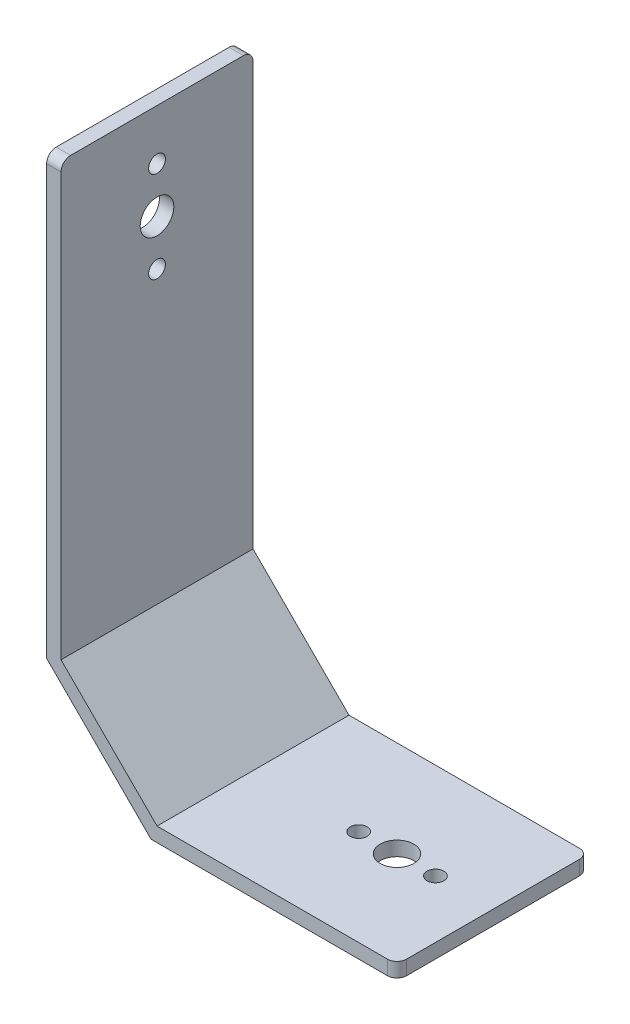
from build123d import *

# Parameters (mm, degrees)
EXTRU_MINCE1_DEPTH      = 40
ESQUISSE2_R             = 1.75
ESQUISSE2_R_2           = 3.5
ENL_V_MAT_EXTRU_1_DEPTH = 3
CONG_3_R                = 2
CONG_4_R                = 2
CONG_5_R                = 2
CONG_6_R                = 2
ESQUISSE3_R             = 1.75
ESQUISSE3_R_2           = 3.5
ENL_V_MAT_EXTRU_2_DEPTH = 50


with BuildPart() as part:
    # Esquisse1 → Extru.-Mince1 (new body)
    with BuildSketch(Plane.XY):
        Polygon((70, -20), (20, -20), (0, 0), (0, 90), (-3, 90), (-3, -1.242640687), (18.757359313, -23), (70, -23), align=None)
    extrude(amount=EXTRU_MINCE1_DEPTH)

    # Esquisse2 → Enlèv. mat.-Extru.1 (cut)
    with BuildSketch(Plane(origin=(0, 0, 0), x_dir=(0, 0, -1), z_dir=(1, 0, 0))):
        with Locations((-20, 79.5)):
            Circle(ESQUISSE2_R)
        with Locations((-20, 60.5)):
            Circle(ESQUISSE2_R)
        with Locations((-20, 70)):
            Circle(ESQUISSE2_R_2)
    extrude(amount=-ENL_V_MAT_EXTRU_1_DEPTH, mode=Mode.SUBTRACT)

    # Congé3
    cong_3_edges = [part.edges().sort_by_distance(p)[0] for p in [
        (-1.5, 90, 40),
    ]]
    fillet(cong_3_edges, radius=CONG_3_R)

    # Congé4
    cong_4_edges = [part.edges().sort_by_distance(p)[0] for p in [
        (-1.5, 90, 0),
    ]]
    fillet(cong_4_edges, radius=CONG_4_R)

    # Congé5
    cong_5_edges = [part.edges().sort_by_distance(p)[0] for p in [
        (70, -21.5, 40),
    ]]
    fillet(cong_5_edges, radius=CONG_5_R)

    # Congé6
    cong_6_edges = [part.edges().sort_by_distance(p)[0] for p in [
        (70, -21.5, 0),
    ]]
    fillet(cong_6_edges, radius=CONG_6_R)

    # Esquisse3 → Enlèv. mat.-Extru.2 (cut)
    with BuildSketch(Plane(origin=(0, 0, 0), x_dir=(1, 0, 0), z_dir=(0, 1, 0))):
        with Locations((58, -20)):
            Circle(ESQUISSE3_R)
        with Locations((42, -20)):
            Circle(ESQUISSE3_R)
        with Locations((50, -20)):
            Circle(ESQUISSE3_R_2)
    extrude(amount=-ENL_V_MAT_EXTRU_2_DEPTH, mode=Mode.SUBTRACT)


solid = part.part
